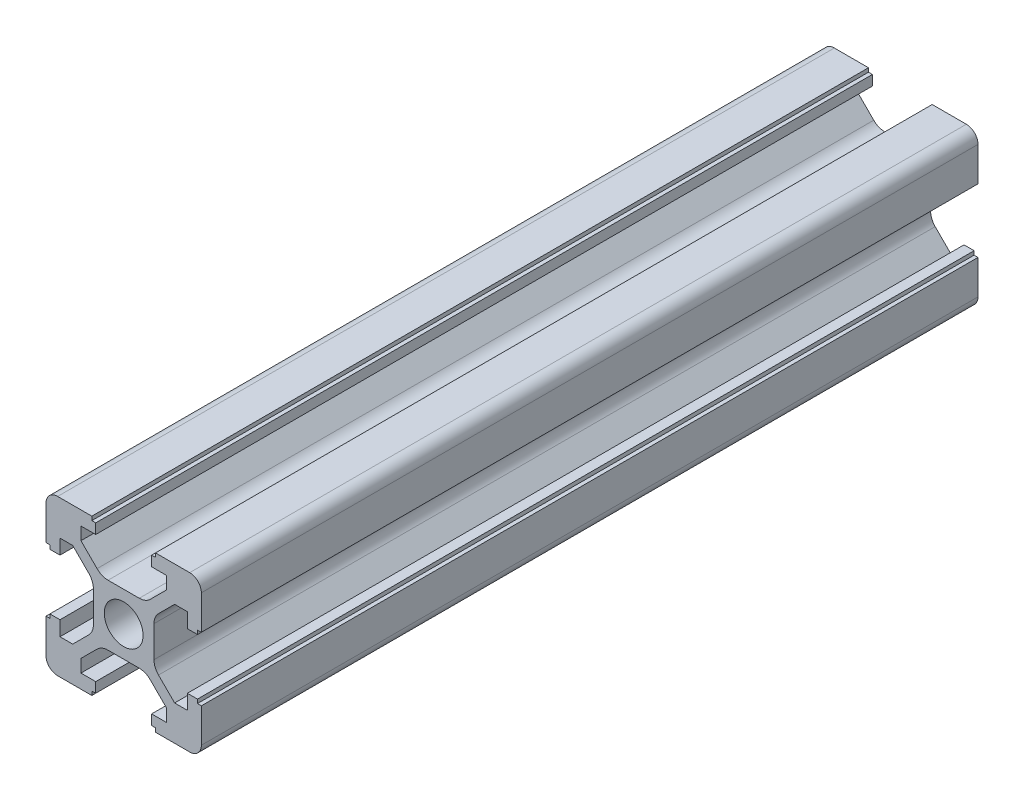
from build123d import *

# Parameters (mm, degrees)
SKETCH1_R           = 2.5
BOSS_EXTRUDE2_DEPTH = 100


with BuildPart() as part:
    # Sketch1 → Boss-Extrude2 (new body)
    with BuildSketch(Plane.XY):
        with BuildLine():
            Line((10, -8.5), (10, -4.1))
            Line((10, -4.1), (9.5, -4.1))
            Line((9.5, -4.1), (9.5, -3.6))
            Line((9.5, -3.6), (8.2, -3.6))
            Line((8.2, -3.6), (8.2, -5.5))
            Line((8.2, -5.5), (6.560660172, -5.5))
            Line((6.560660172, -5.5), (4.485786438, -3.425126266))
            ThreePointArc((4.485786438, -3.425126266), (4.052240935, -2.776279568), (3.9, -2.010912703))
            Line((3.9, -2.010912703), (3.9, 2.010912703))
            ThreePointArc((3.9, 2.010912703), (4.052240935, 2.776279568), (4.485786438, 3.425126266))
            Line((4.485786438, 3.425126266), (6.560660172, 5.5))
            Line((6.560660172, 5.5), (8.2, 5.5))
            Line((8.2, 5.5), (8.2, 3.6))
            Line((8.2, 3.6), (9.5, 3.6))
            Line((9.5, 3.6), (9.5, 4.1))
            Line((9.5, 4.1), (10, 4.1))
            Line((10, 4.1), (10, 8.5))
            ThreePointArc((10, 8.5), (9.560660172, 9.560660172), (8.5, 10))
            Line((8.5, 10), (4.1, 10))
            Line((4.1, 10), (4.1, 9.5))
            Line((4.1, 9.5), (3.6, 9.5))
            Line((3.6, 9.5), (3.6, 8.2))
            Line((3.6, 8.2), (5.5, 8.2))
            Line((5.5, 8.2), (5.5, 6.560660172))
            Line((5.5, 6.560660172), (3.425126266, 4.485786438))
            ThreePointArc((3.425126266, 4.485786438), (2.776279568, 4.052240935), (2.010912703, 3.9))
            Line((2.010912703, 3.9), (-2.010912703, 3.9))
            ThreePointArc((-2.010912703, 3.9), (-2.776279568, 4.052240935), (-3.425126266, 4.485786438))
            Line((-3.425126266, 4.485786438), (-5.5, 6.560660172))
            Line((-5.5, 6.560660172), (-5.5, 8.2))
            Line((-5.5, 8.2), (-3.6, 8.2))
            Line((-3.6, 8.2), (-3.6, 9.5))
            Line((-3.6, 9.5), (-4.1, 9.5))
            Line((-4.1, 9.5), (-4.1, 10))
            Line((-4.1, 10), (-8.5, 10))
            ThreePointArc((-8.5, 10), (-9.560660172, 9.560660172), (-10, 8.5))
            Line((-10, 8.5), (-10, 4.1))
            Line((-10, 4.1), (-9.5, 4.1))
            Line((-9.5, 4.1), (-9.5, 3.6))
            Line((-9.5, 3.6), (-8.2, 3.6))
            Line((-8.2, 3.6), (-8.2, 5.5))
            Line((-8.2, 5.5), (-6.560660172, 5.5))
            Line((-6.560660172, 5.5), (-4.485786438, 3.425126266))
            ThreePointArc((-4.485786438, 3.425126266), (-4.052240935, 2.776279568), (-3.9, 2.010912703))
            Line((-3.9, 2.010912703), (-3.9, -2.010912703))
            ThreePointArc((-3.9, -2.010912703), (-4.052240935, -2.776279568), (-4.485786438, -3.425126266))
            Line((-4.485786438, -3.425126266), (-6.560660172, -5.5))
            Line((-6.560660172, -5.5), (-8.2, -5.5))
            Line((-8.2, -5.5), (-8.2, -3.6))
            Line((-8.2, -3.6), (-9.5, -3.6))
            Line((-9.5, -3.6), (-9.5, -4.1))
            Line((-9.5, -4.1), (-10, -4.1))
            Line((-10, -4.1), (-10, -8.5))
            ThreePointArc((-10, -8.5), (-9.560660172, -9.560660172), (-8.5, -10))
            Line((-8.5, -10), (-4.1, -10))
            Line((-4.1, -10), (-4.1, -9.5))
            Line((-4.1, -9.5), (-3.6, -9.5))
            Line((-3.6, -9.5), (-3.6, -8.2))
            Line((-3.6, -8.2), (-5.5, -8.2))
            Line((-5.5, -8.2), (-5.5, -6.560660172))
            Line((-5.5, -6.560660172), (-3.425126266, -4.485786438))
            ThreePointArc((-3.425126266, -4.485786438), (-2.776279568, -4.052240935), (-2.010912703, -3.9))
            Line((-2.010912703, -3.9), (2.010912703, -3.9))
            ThreePointArc((2.010912703, -3.9), (2.776279568, -4.052240935), (3.425126266, -4.485786438))
            Line((3.425126266, -4.485786438), (5.5, -6.560660172))
            Line((5.5, -6.560660172), (5.5, -8.2))
            Line((5.5, -8.2), (3.6, -8.2))
            Line((3.6, -8.2), (3.6, -9.5))
            Line((3.6, -9.5), (4.1, -9.5))
            Line((4.1, -9.5), (4.1, -10))
            Line((4.1, -10), (8.5, -10))
            ThreePointArc((8.5, -10), (9.560660172, -9.560660172), (10, -8.5))
        make_face()
        Circle(SKETCH1_R, mode=Mode.SUBTRACT)
    extrude(amount=BOSS_EXTRUDE2_DEPTH)


solid = part.part
